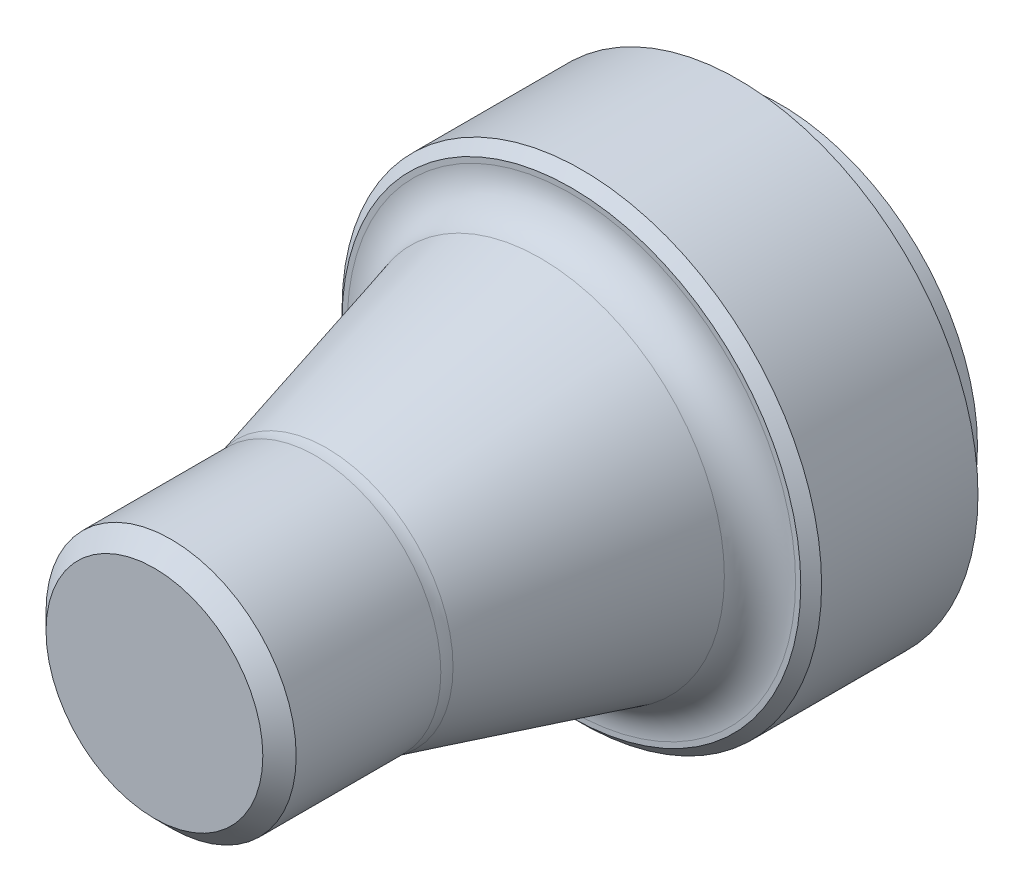
from build123d import *

# Parameters (mm, degrees)
SKETCH1_R           = 30.0863
BOSS_EXTRUDE1_DEPTH = 6.35
SKETCH2_R           = 36.5125
BOSS_EXTRUDE2_DEPTH = 25.4
SKETCH3_R           = 19.05
BOSS_EXTRUDE3_DEPTH = 38.1
DRAFT1_ANGLE        = 15
SKETCH4_R           = 19.05
BOSS_EXTRUDE4_DEPTH = 25.4
CHAMFER1_SIZE       = 2.54
FILLET1_R           = 6.35
CHAMFER2_SIZE       = 1.5875


with BuildPart() as part:
    # Sketch1 → Boss-Extrude1 (new body)
    with BuildSketch(Plane.XY):
        Circle(SKETCH1_R)
    extrude(amount=-BOSS_EXTRUDE1_DEPTH)

    # Sketch2 → Boss-Extrude2 (add)
    with BuildSketch(Plane.XY):
        Circle(SKETCH2_R)
    extrude(amount=BOSS_EXTRUDE2_DEPTH)

    # Sketch3 → Boss-Extrude3 (add)
    with BuildSketch(Plane.XY.offset(25.4)):
        Circle(SKETCH3_R)
    extrude(amount=BOSS_EXTRUDE3_DEPTH)

    # Draft1
    draft1_faces = [part.faces().sort_by_distance(p)[0] for p in [
        (-19.05, 0, 44.45),
    ]]
    draft(draft1_faces, Plane.XY.offset(63.5), DRAFT1_ANGLE)

    # Sketch4 → Boss-Extrude4 (add)
    with BuildSketch(Plane.XY.offset(63.5)):
        Circle(SKETCH4_R)
    extrude(amount=BOSS_EXTRUDE4_DEPTH)

    # Chamfer1
    chamfer1_edges = [part.edges().sort_by_distance(p)[0] for p in [
        (-19.05, 0, 88.9),
    ]]
    chamfer(chamfer1_edges, length=CHAMFER1_SIZE)

    # Fillet1
    fillet1_edges = [part.edges().sort_by_distance(p)[0] for p in [
        (-29.258864232, 0, 25.4),
        (-19.05, 0, 63.5),
    ]]
    fillet(fillet1_edges, radius=FILLET1_R)

    # Chamfer2
    chamfer2_edges = [part.edges().sort_by_distance(p)[0] for p in [
        (-36.5125, 0, 25.4),
    ]]
    chamfer(chamfer2_edges, length=CHAMFER2_SIZE)


solid = part.part
